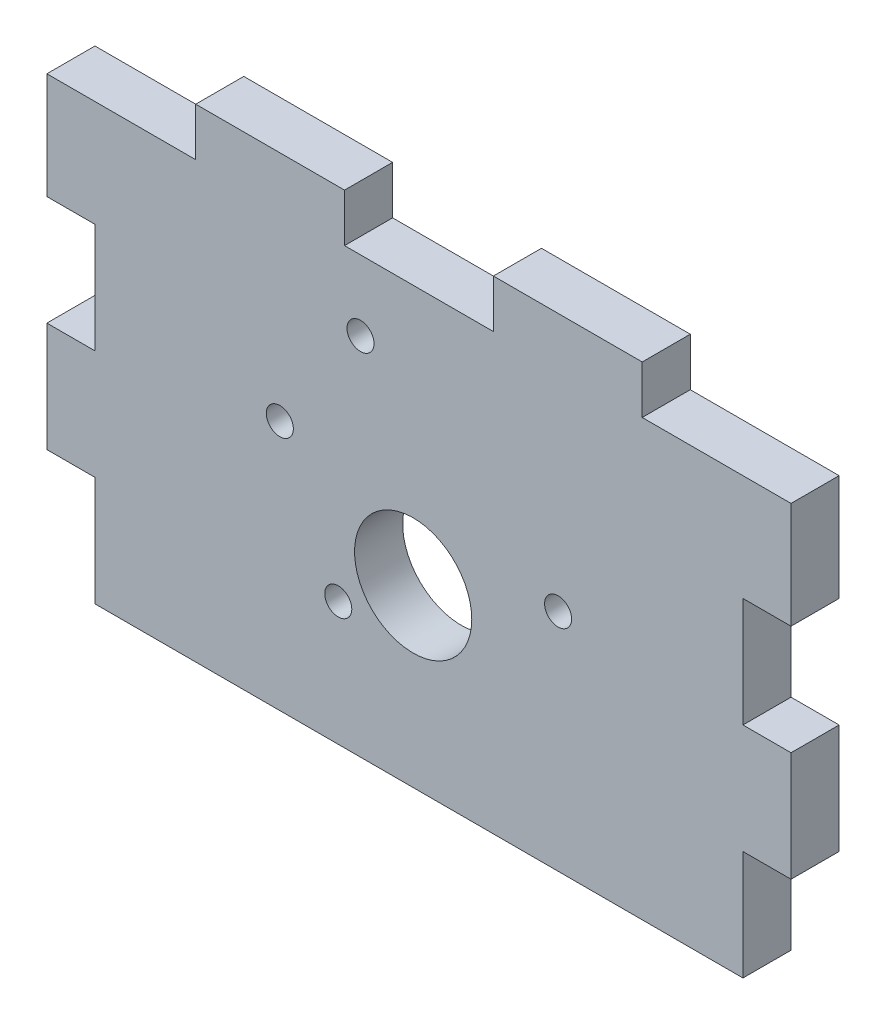
from build123d import *

# Parameters (mm, degrees)
SKETCH1_W                = 82.55
SKETCH1_H                = 53.594
BOSS_EXTRUDE1_DEPTH      = 5.334
CUT_EXTRUDE1_START       = -88.085249325
CUT_EXTRUDE1_OUTLINE_W   = 5.334
CUT_EXTRUDE1_OUTLINE_H   = 5.334
CUT_EXTRUDE1_DEPTH       = 16.51
CUT_EXTRUDE1_START_2     = -55.065249325
CUT_EXTRUDE1_2_OUTLINE_W = 5.334
CUT_EXTRUDE1_2_OUTLINE_H = 5.334
CUT_EXTRUDE1_2_DEPTH     = 16.51
CUT_EXTRUDE1_START_3     = -22.045249325
CUT_EXTRUDE1_3_OUTLINE_W = 5.334
CUT_EXTRUDE1_3_OUTLINE_H = 5.334
CUT_EXTRUDE1_3_DEPTH     = 16.51
SKETCH3_W                = 5.334
SKETCH3_H                = 12.154056038
CUT_EXTRUDE2_DEPTH       = 97.676684204
SKETCH5_R                = 1.5
SKETCH5_R_2              = 6.5
CUT_EXTRUDE4_DEPTH       = 97.676684204


# Read off the part's stored shape, not the designer's step: Cut-Extrude1
with BuildPart() as part:
    # Sketch1 → Boss-Extrude1 (new body)
    with BuildSketch(Plane.XY):
        with Locations((-46.810249325, -12.686142782)):
            Rectangle(SKETCH1_W, SKETCH1_H)
    extrude(amount=BOSS_EXTRUDE1_DEPTH)

    # Cut-Extrude1 outline → Cut-Extrude1 (cut)
    with BuildSketch(Plane.YZ.offset(CUT_EXTRUDE1_START)):
        with Locations((11.443857218, 2.667)):
            Rectangle(CUT_EXTRUDE1_OUTLINE_W, CUT_EXTRUDE1_OUTLINE_H)
    extrude(amount=CUT_EXTRUDE1_DEPTH, mode=Mode.SUBTRACT)

    # Cut-Extrude1 2 outline → Cut-Extrude1 2 (cut)
    with BuildSketch(Plane.YZ.offset(CUT_EXTRUDE1_START_2)):
        with Locations((11.443857218, 2.667)):
            Rectangle(CUT_EXTRUDE1_2_OUTLINE_W, CUT_EXTRUDE1_2_OUTLINE_H)
    extrude(amount=CUT_EXTRUDE1_2_DEPTH, mode=Mode.SUBTRACT)

    # Cut-Extrude1 3 outline → Cut-Extrude1 3 (cut)
    with BuildSketch(Plane.YZ.offset(CUT_EXTRUDE1_START_3)):
        with Locations((11.443857218, 2.667)):
            Rectangle(CUT_EXTRUDE1_3_OUTLINE_W, CUT_EXTRUDE1_3_OUTLINE_H)
    extrude(amount=CUT_EXTRUDE1_3_DEPTH, mode=Mode.SUBTRACT)

    # Sketch3 → Cut-Extrude2 (cut, through all)
    with BuildSketch(Plane.XY.offset(5.334)):
        with Locations((-85.418249325, -33.406114763)):
            Rectangle(SKETCH3_W, SKETCH3_H)
        with Locations((-85.418249325, -9.098002686)):
            Rectangle(SKETCH3_W, SKETCH3_H)
        with Locations((-8.202249325, -33.406114763)):
            Rectangle(SKETCH3_W, SKETCH3_H)
        with Locations((-8.202249325, -9.098002686)):
            Rectangle(SKETCH3_W, SKETCH3_H)
    extrude(amount=-CUT_EXTRUDE2_DEPTH, mode=Mode.SUBTRACT)

    # Sketch5 → Cut-Extrude4 (cut, through all)
    with BuildSketch(Plane.XY.offset(5.334)):
        with Locations((-62.244676311, -11.668301366)):
            Circle(SKETCH5_R)
        with Locations((-55.760892065, -25.747027937)):
            Circle(SKETCH5_R)
        with Locations((-53.29403357, 0.986183789)):
            Circle(SKETCH5_R)
        with Locations((-31.375822338, -14.516784198)):
            Circle(SKETCH5_R)
        with Locations((-47.453455125, -20.062929163)):
            Circle(SKETCH5_R_2)
    extrude(amount=-CUT_EXTRUDE4_DEPTH, mode=Mode.SUBTRACT)


solid = part.part
